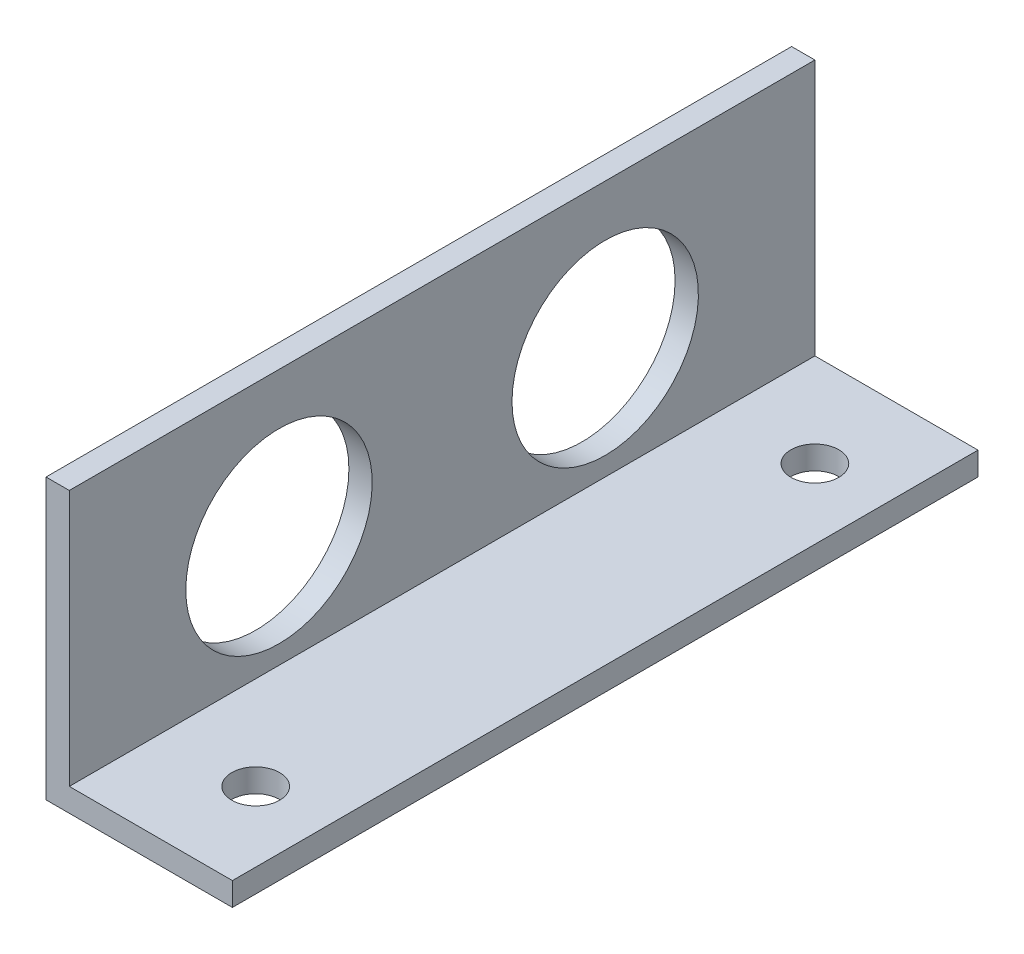
from build123d import *

# Parameters (mm, degrees)
BOSS_EXTRUDE1_DEPTH       = 25.4
SKETCH3_R                 = 6.35
CUT_EXTRUDE1_DEPTH        = 35.195796525
F_4_CLEARANCE_HOLE1_D     = 3.2639
F_4_CLEARANCE_HOLE1_DEPTH = 3.175
F_4_CLEARANCE_HOLE1_TIP   = 0.980574487


with BuildPart() as part:
    # Sketch1 → Boss-Extrude1 (new, symmetric)
    with BuildSketch(Plane.XY):
        Polygon((0, 0), (12.7, 0), (12.7, 1.5875), (1.5875, 1.5875), (1.5875, 19.05), (0, 19.05), align=None)
    extrude(amount=BOSS_EXTRUDE1_DEPTH, both=True)

    # Sketch3 → Cut-Extrude1 (cut, through all)
    with BuildSketch(Plane.ZY):
        with Locations((11.1125, 9.2075)):
            Circle(SKETCH3_R)
        with Locations((-11.1125, 9.2075)):
            Circle(SKETCH3_R)
    extrude(amount=-CUT_EXTRUDE1_DEPTH, mode=Mode.SUBTRACT)

    # #4 Clearance Hole1
    with Locations(Plane(origin=(0, 1.5875, 0), x_dir=(1, 0, 0), z_dir=(0, 1, 0))):
        with Locations((7.9375, 19.05), (7.9375, -19.05)):
            Hole(F_4_CLEARANCE_HOLE1_D / 2, depth=F_4_CLEARANCE_HOLE1_DEPTH)
            with Locations((0, 0, -(F_4_CLEARANCE_HOLE1_DEPTH + F_4_CLEARANCE_HOLE1_TIP / 2))):  # 118° drill point
                Cone(0, F_4_CLEARANCE_HOLE1_D / 2, F_4_CLEARANCE_HOLE1_TIP, mode=Mode.SUBTRACT)


solid = part.part
